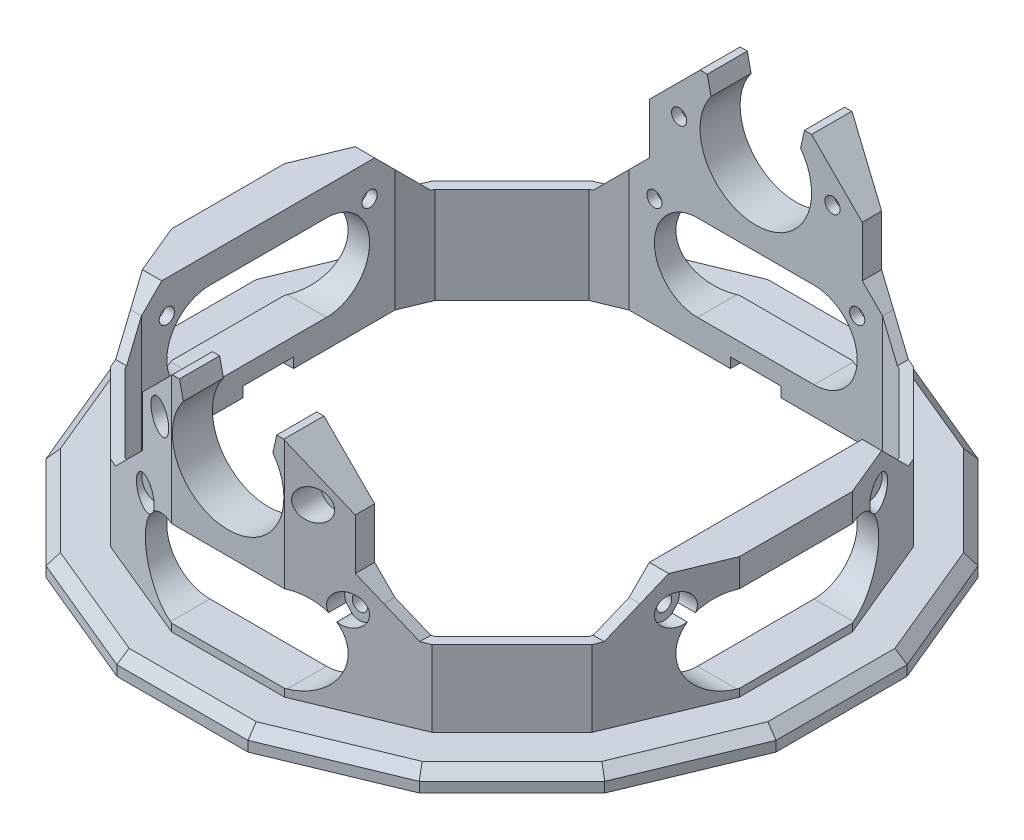
from build123d import *

# Parameters (mm, degrees)
BOSS_EXTRUDE1_DEPTH    = 4
CHAMFER1_SIZE          = 2
SHELL1_T               = -2
BOSS_EXTRUDE2_DEPTH    = 19
BOSS_EXTRUDE4_DEPTH    = 28
CUT_EXTRUDE1_REACH     = 142.178
CUT_EXTRUDE2_REACH     = 142.178
CHAMFER2_SIZE          = 4
CHAMFER3_SIZE          = 5
BOSS_EXTRUDE6_DEPTH    = 20
CHAMFER4_SIZE          = 10
CUT_EXTRUDE3_REACH     = 147.499
SKETCH8_R              = 11
CUT_EXTRUDE4_START     = -110
CUT_EXTRUDE4_OUTLINE_R = 1.5
CUT_EXTRUDE4_DEPTH     = 108
SKETCH10_R             = 3
CUT_EXTRUDE5_DEPTH     = 6
CUT_EXTRUDE6_REACH     = 147.499
SKETCH11_R             = 1.5
SKETCH12_R             = 3
CUT_EXTRUDE7_DEPTH     = 6
CHAMFER6_SIZE          = 5
CUT_EXTRUDE8_START     = -110.970304
SKETCH14_R             = 1.5
CUT_EXTRUDE8_DEPTH     = 109.940608
SKETCH15_R             = 3
CUT_EXTRUDE9_DEPTH     = 6
SKETCH17_W             = 10
SKETCH17_H             = 8.734587369
SKETCH17_W_2           = 8.734587369
SKETCH17_H_2           = 10
CUT_EXTRUDE10_DEPTH    = 2


with BuildPart() as part:
    # Sketch1 → Boss-Extrude1 (new body)
    with BuildSketch(Plane(origin=(0, 0, 0), x_dir=(1, 0, 0), z_dir=(0, 1, 0))):
        Polygon((36.819542328, 55.104339226), (12.92930388, 65), (-12.92930388, 65), (-36.819542328, 55.104339226), (-55.104339226, 36.819542328), (-65, 12.92930388), (-65, -12.92930388), (-55.104339226, -36.819542328), (-36.819542328, -55.104339226), (-12.92930388, -65), (12.92930388, -65), (36.819542328, -55.104339226), (55.104339226, -36.819542328), (65, -12.92930388), (65, 12.92930388), (55.104339226, 36.819542328), align=None)
        Polygon((10.741267839, 54), (-10.741267839, 54), (-30.588542857, 45.778989511), (-45.778989511, 30.588542857), (-54, 10.741267839), (-54, -10.741267839), (-45.778989511, -30.588542857), (-30.588542857, -45.778989511), (-10.741267839, -54), (10.741267839, -54), (30.588542857, -45.778989511), (45.778989511, -30.588542857), (54, -10.741267839), (54, 10.741267839), (45.778989511, 30.588542857), (30.588542857, 45.778989511), align=None, mode=Mode.SUBTRACT)
    extrude(amount=BOSS_EXTRUDE1_DEPTH)

    # Chamfer1
    chamfer1_edges = [part.edges().sort_by_distance(p)[0] for p in [
        (0, 4, -65),
        (-24.874423104, 4, -60.052169613),
        (-45.961940777, 4, -45.961940777),
        (-60.052169613, 4, -24.874423104),
        (-65, 4, 0),
        (-60.052169613, 4, 24.874423104),
        (-45.961940777, 4, 45.961940777),
        (-24.874423104, 4, 60.052169613),
        (0, 4, 65),
        (24.874423104, 4, 60.052169613),
        (45.961940777, 4, -45.961940777),
        (45.961940777, 4, 45.961940777),
        (60.052169613, 4, 24.874423104),
        (20.664905348, 4, -49.889494756),
        (0, 4, -54),
        (-20.664905348, 4, -49.889494756),
        (-38.183766184, 4, -38.183766184),
        (-49.889494756, 4, -20.664905348),
        (-54, 4, 0),
        (-49.889494756, 4, 20.664905348),
        (65, 4, 0),
        (-38.183766184, 4, 38.183766184),
        (-20.664905348, 4, 49.889494756),
        (0, 4, 54),
        (20.664905348, 4, 49.889494756),
        (38.183766184, 4, 38.183766184),
        (49.889494756, 4, 20.664905348),
        (54, 4, 0),
        (49.889494756, 4, -20.664905348),
        (38.183766184, 4, -38.183766184),
        (60.052169613, 4, -24.874423104),
        (24.874423104, 4, -60.052169613),
    ]]
    chamfer(chamfer1_edges, length=CHAMFER1_SIZE)

    # Shell1
    shell1_openings = [part.faces().sort_by_distance(p)[0] for p in [
        (24.170868174, 0, -58.353637759),
    ]]
    offset(amount=SHELL1_T, openings=shell1_openings, kind=Kind.INTERSECTION)

    # Sketch2 → Boss-Extrude2 (add)
    with BuildSketch(Plane.XZ):
        Polygon((47.474507641, -31.721451852), (56, -11.139092573), (56, 11.139092573), (47.474507641, 31.721451852), (31.721451852, 47.474507641), (11.139092573, 56), (-11.139092573, 56), (-31.721451852, 47.474507641), (-47.474507641, 31.721451852), (-56, 11.139092573), (-56, -11.139092573), (-47.474507641, -31.721451852), (-31.721451852, -47.474507641), (-11.139092573, -56), (11.139092573, -56), (31.721451852, -47.474507641), align=None)
        Polygon((45.778989511, -30.588542857), (54, -10.741267839), (54, 10.741267839), (45.778989511, 30.588542857), (30.588542857, 45.778989511), (10.741267839, 54), (-10.741267839, 54), (-30.588542857, 45.778989511), (-45.778989511, 30.588542857), (-54, 10.741267839), (-54, -10.741267839), (-45.778989511, -30.588542857), (-30.588542857, -45.778989511), (-10.741267839, -54), (10.741267839, -54), (30.588542857, -45.778989511), align=None, mode=Mode.SUBTRACT)
    extrude(amount=-BOSS_EXTRUDE2_DEPTH)

    # Sketch3 → Boss-Extrude4 (add)
    with BuildSketch(Plane.XZ):
        Polygon((-25, 50.258624157), (-25, 48.093839756), (25, 48.093839756), (25, 50.258624157), (11.139092573, 56), (-11.139092573, 56), align=None)
        Polygon((50.258624157, -25), (56, -11.139092573), (56, 11.139092573), (50.258624157, 25), (48.093839756, 25), (48.093839756, -25), align=None)
        Polygon((-25, -50.258624157), (-11.139092573, -56), (11.139092573, -56), (25, -50.258624157), (25, -48.093839756), (-25, -48.093839756), align=None)
        Polygon((-50.258624157, 25), (-56, 11.139092573), (-56, -11.139092573), (-50.258624157, -25), (-48.093839756, -25), (-48.093839756, 25), align=None)
    extrude(amount=-BOSS_EXTRUDE4_DEPTH)

    # Cut-Extrude1: up to this face of the body (flat: up to its plane)
    cut_extrude1_end = Plane(part.part.faces().sort_by_distance((0, 16, -56))[0])
    # Sketch4 → Cut-Extrude1 (cut, up to the picked face)
    with BuildSketch(Plane.XY.offset(56), mode=Mode.PRIVATE) as cut_extrude1_sk1:
        with BuildLine():
            Line((-11.5, 22.5), (11.5, 22.5))
            ThreePointArc((11.5, 22.5), (20, 14), (11.5, 5.5))
            Line((11.5, 5.5), (-11.5, 5.5))
            ThreePointArc((-11.5, 5.5), (-20, 14), (-11.5, 22.5))
        make_face()
    cut_extrude1_tool1 = split(extrude(cut_extrude1_sk1.sketch, amount=-CUT_EXTRUDE1_REACH, mode=Mode.PRIVATE), bisect_by=cut_extrude1_end, keep=Keep.BOTH, mode=Mode.PRIVATE)
    add(cut_extrude1_tool1.solids().sort_by(Axis((0, 14, 56), (0, 0, -1)))[0], mode=Mode.SUBTRACT)

    # Cut-Extrude2: up to this face of the body (flat: up to its plane)
    cut_extrude2_end = Plane(part.part.faces().sort_by_distance((56, 16, 0))[0])
    # Sketch5 → Cut-Extrude2 (cut, up to the picked face)
    with BuildSketch(Plane.ZY.offset(56), mode=Mode.PRIVATE) as cut_extrude2_sk1:
        with BuildLine():
            Line((-11.5, 22.5), (11.5, 22.5))
            ThreePointArc((11.5, 22.5), (20, 14), (11.5, 5.5))
            Line((11.5, 5.5), (-11.5, 5.5))
            ThreePointArc((-11.5, 5.5), (-20, 14), (-11.5, 22.5))
        make_face()
    cut_extrude2_tool1 = split(extrude(cut_extrude2_sk1.sketch, amount=-CUT_EXTRUDE2_REACH, mode=Mode.PRIVATE), bisect_by=cut_extrude2_end, keep=Keep.BOTH, mode=Mode.PRIVATE)
    add(cut_extrude2_tool1.solids().sort_by(Axis((-56, 14, 0), (1, 0, 0)))[0], mode=Mode.SUBTRACT)

    # Chamfer2
    chamfer2_edges = [part.edges().sort_by_distance(p)[0] for p in [
        (25, 28, 49.176231957),
        (-25, 28, 49.176231957),
        (49.176231957, 28, 25),
        (49.176231957, 28, -25),
        (25, 28, -49.176231957),
        (-25, 28, -49.176231957),
        (-49.176231957, 28, -25),
        (-49.176231957, 28, 25),
    ]]
    chamfer(chamfer2_edges, length=CHAMFER2_SIZE)

    # Chamfer3
    chamfer3_edges = [part.edges().sort_by_distance(p)[0] for p in [
        (25, 19, -49.176231957),
        (49.176231957, 19, -25),
        (25, 19, 49.176231957),
        (49.176231957, 19, 25),
        (-25, 19, 49.176231957),
        (-49.176231957, 19, 25),
        (-49.176231957, 19, -25),
        (-25, 19, -49.176231957),
    ]]
    chamfer(chamfer3_edges, length=CHAMFER3_SIZE - 0.0001)  # a hair under: the kernel refuses the full size

    # Sketch6 → Boss-Extrude6 (add)
    with BuildSketch(Plane(origin=(0, 28, 0), x_dir=(1, 0, 0), z_dir=(0, 1, 0))):
        Polygon((-21, 51.915478407), (-21, 48.093839756), (21, 48.093839756), (21, 51.915478407), (11.139092573, 56), (-11.139092573, 56), align=None)
        Polygon((11.139092573, -56), (-11.139092573, -56), (-21, -51.915478407), (-21, -48.093839756), (21, -48.093839756), (21, -51.915478407), align=None)
    extrude(amount=BOSS_EXTRUDE6_DEPTH)

    # Chamfer4
    chamfer4_edges = [part.edges().sort_by_distance(p)[0] for p in [
        (-21, 48, -50.004659082),
        (21, 48, -50.004659082),
        (21, 48, 50.004659082),
        (-21, 48, 50.004659082),
    ]]
    chamfer(chamfer4_edges, length=CHAMFER4_SIZE)

    # Cut-Extrude3: up to this face of the body (flat: up to its plane)
    cut_extrude3_end = Plane(part.part.faces().sort_by_distance((0, 35.249567356, 56))[0])
    # Sketch8 → Cut-Extrude3 (cut, up to the picked face)
    with BuildSketch(Plane(origin=(0, 0, -56), x_dir=(-1, 0, 0), z_dir=(0, 0, -1)), mode=Mode.PRIVATE) as cut_extrude3_sk1:
        with Locations((0, 38)):
            Circle(SKETCH8_R)
    cut_extrude3_tool1 = split(extrude(cut_extrude3_sk1.sketch, amount=-CUT_EXTRUDE3_REACH, mode=Mode.PRIVATE), bisect_by=cut_extrude3_end, keep=Keep.BOTH, mode=Mode.PRIVATE)
    add(cut_extrude3_tool1.solids().sort_by(Axis((0, 38, -56), (0, 0, 1)))[0], mode=Mode.SUBTRACT)

    # Cut-Extrude4: read off the stored shape, not the designer's step
    # Cut-Extrude4 outline → Cut-Extrude4 (cut)
    with BuildSketch(Plane(origin=(0, 0, -56), x_dir=(-1, 0, 0), z_dir=(0, 0, -1)).offset(CUT_EXTRUDE4_START)):
        with Locations((20, 21.5)):
            Circle(CUT_EXTRUDE4_OUTLINE_R)
        with Locations((-20, 21.5)):
            Circle(CUT_EXTRUDE4_OUTLINE_R)
    extrude(amount=CUT_EXTRUDE4_DEPTH, mode=Mode.SUBTRACT)

    # Sketch10 → Cut-Extrude5 (cut)
    with BuildSketch(Plane(origin=(0, 0, -56), x_dir=(-1, 0, 0), z_dir=(0, 0, -1))):
        with Locations((-20, 21.5)):
            Circle(SKETCH10_R)
        with Locations((20, 21.5)):
            Circle(SKETCH10_R)
    cut_extrude5 = extrude(amount=-CUT_EXTRUDE5_DEPTH, mode=Mode.SUBTRACT)

    # Mirror1: Cut-Extrude5 across plane
    add(cut_extrude5.mirror(Plane.XY), mode=Mode.SUBTRACT)

    # Cut-Extrude6: up to this face of the body (flat: up to its plane)
    cut_extrude6_end = Plane(part.part.faces().sort_by_distance((-56, 25.25, 0))[0])
    # Sketch11 → Cut-Extrude6 (cut, up to the picked face)
    with BuildSketch(Plane(origin=(56, 0, 0), x_dir=(0, 0, -1), z_dir=(1, 0, 0)), mode=Mode.PRIVATE) as cut_extrude6_sk1:
        with Locations((-20, 21.5)):
            Circle(SKETCH11_R)
    cut_extrude6_tool1 = split(extrude(cut_extrude6_sk1.sketch, amount=-CUT_EXTRUDE6_REACH, mode=Mode.PRIVATE), bisect_by=cut_extrude6_end, keep=Keep.BOTH, mode=Mode.PRIVATE)
    # Sketch11 → Cut-Extrude6 (cut, up to the picked face)
    with BuildSketch(Plane(origin=(56, 0, 0), x_dir=(0, 0, -1), z_dir=(1, 0, 0)), mode=Mode.PRIVATE) as cut_extrude6_sk2:
        with Locations(Location((20, 21.5, 0), (0, 0, 180))):
            Circle(SKETCH11_R)
    cut_extrude6_tool2 = split(extrude(cut_extrude6_sk2.sketch, amount=-CUT_EXTRUDE6_REACH, mode=Mode.PRIVATE), bisect_by=cut_extrude6_end, keep=Keep.BOTH, mode=Mode.PRIVATE)
    add(cut_extrude6_tool1.solids().sort_by(Axis((56, 21.5, 20), (-1, 0, 0)))[0], mode=Mode.SUBTRACT)
    add(cut_extrude6_tool2.solids().sort_by(Axis((56, 21.5, -20), (-1, 0, 0)))[0], mode=Mode.SUBTRACT)

    # Sketch12 → Cut-Extrude7 (cut)
    with BuildSketch(Plane(origin=(56, 0, 0), x_dir=(0, 0, -1), z_dir=(1, 0, 0))):
        with Locations((20, 21.5)):
            Circle(SKETCH12_R)
        with Locations((-20, 21.5)):
            Circle(SKETCH12_R)
    cut_extrude7 = extrude(amount=-CUT_EXTRUDE7_DEPTH, mode=Mode.SUBTRACT)

    # Mirror2: Cut-Extrude7 across plane
    add(cut_extrude7.mirror(Plane(origin=(0, 0, 0), x_dir=(0, 0, 1), z_dir=(1, 0, 0))), mode=Mode.SUBTRACT)

    # Chamfer6
    # the kernel refuses this chamfer: 5 mm, written as the material it takes off along each edge
    with BuildSketch(Plane(origin=(-4.582575695, 48, -34.191507516), x_dir=(-1, 0, 0), z_dir=(0, 0, -1))) as chamfer6_piece_1:
        with BuildLine():
            Line((CHAMFER6_SIZE, 0), (4.248865458, -3.442130897))
            ThreePointArc((4.248865458, -3.442130897), (2.37801953, -1.482364524), (0, 0))
            Line((0, 0), (CHAMFER6_SIZE, 0))
        make_face()
    extrude(amount=35.710824725, mode=Mode.SUBTRACT)
    with BuildSketch(Plane(origin=(4.582575695, 48, -34.191507516), x_dir=(0.7770146925476212, -0.62948246009331, 0), z_dir=(0, 0, -1))) as chamfer6_piece_2:
        with BuildLine():
            Line((5.468191912, 0), (CHAMFER6_SIZE * 0.777014692548, -CHAMFER6_SIZE * 0.629482460093))
            Line((CHAMFER6_SIZE * 0.777014692548, -CHAMFER6_SIZE * 0.629482460093), (0, 0))
            ThreePointArc((0, 0), (2.780878581, -0.34510257), (5.468191912, 0))
        make_face()
    extrude(amount=35.710824725, mode=Mode.SUBTRACT)
    with BuildSketch(Plane(origin=(-4.582575695, 48, 69.902332241), x_dir=(-0.7770146925476211, -0.6294824600933101, 0), z_dir=(0, 0, -1))) as chamfer6_piece_3:
        with BuildLine():
            Line((5.468191912, 0), (CHAMFER6_SIZE * 0.777014692548, CHAMFER6_SIZE * 0.629482460093))
            Line((CHAMFER6_SIZE * 0.777014692548, CHAMFER6_SIZE * 0.629482460093), (0, 0))
            ThreePointArc((0, 0), (2.780878581, 0.34510257), (5.468191912, 0))
        make_face()
    extrude(amount=35.710824725, mode=Mode.SUBTRACT)
    with BuildSketch(Plane(origin=(4.582575695, 48, 69.902332241), x_dir=(1, 0, 0), z_dir=(0, 0, -1))) as chamfer6_piece_4:
        with BuildLine():
            Line((CHAMFER6_SIZE, 0), (4.248865458, 3.442130897))
            ThreePointArc((4.248865458, 3.442130897), (2.37801953, 1.482364524), (0, 0))
            Line((0, 0), (CHAMFER6_SIZE, 0))
        make_face()
    extrude(amount=35.710824725, mode=Mode.SUBTRACT)

    # Sketch14 → Cut-Extrude8 (cut)
    with BuildSketch(Plane.XY.offset(56).offset(CUT_EXTRUDE8_START)):
        with Locations((-15.125, 38)):
            Circle(SKETCH14_R)
        with Locations(Location((15.125, 38, 0), (0, 0, 180))):
            Circle(SKETCH14_R)
    extrude(amount=CUT_EXTRUDE8_DEPTH, mode=Mode.SUBTRACT)

    # Sketch15 → Cut-Extrude9 (cut)
    with BuildSketch(Plane.XY.offset(56)):
        with Locations((-15.125, 38)):
            Circle(SKETCH15_R)
        with Locations((15.125, 38)):
            Circle(SKETCH15_R)
    cut_extrude9 = extrude(amount=-CUT_EXTRUDE9_DEPTH, mode=Mode.SUBTRACT)

    # Mirror3: Cut-Extrude9 across plane
    add(cut_extrude9.mirror(Plane.XY), mode=Mode.SUBTRACT)

    # Sketch17 → Cut-Extrude10 (cut)
    with BuildSketch(Plane.XZ):
        with Locations((0, 52.461133441)):
            Rectangle(SKETCH17_W, SKETCH17_H)
        with Locations((52.461133441, 0)):
            Rectangle(SKETCH17_W_2, SKETCH17_H_2)
        with Locations((0, -52.461133441)):
            Rectangle(SKETCH17_W, SKETCH17_H)
        with Locations((-52.461133441, 0)):
            Rectangle(SKETCH17_W_2, SKETCH17_H_2)
    extrude(amount=-CUT_EXTRUDE10_DEPTH, mode=Mode.SUBTRACT)


solid = part.part
